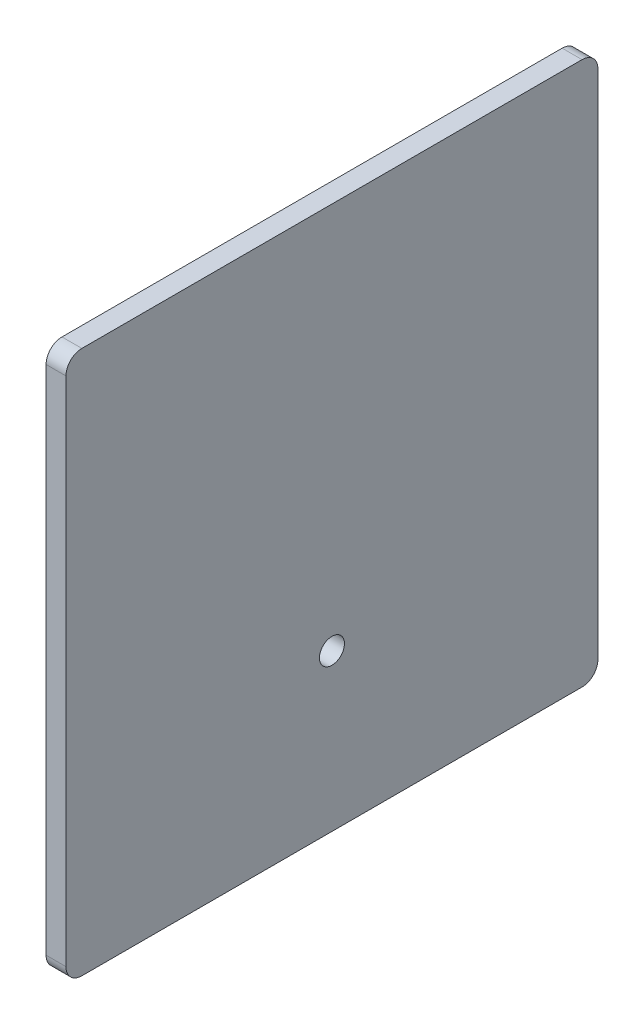
from build123d import *

# Parameters (mm, degrees)
SKETCH1_W           = 84.999999926
SKETCH1_H           = 86.825000086
BOSS_EXTRUDE1_DEPTH = 3.175
SKETCH2_R           = 2
CUT_EXTRUDE1_DEPTH  = 61.835645652
FILLET1_R           = 2.54


with BuildPart() as part:
    # Sketch1 → Boss-Extrude1 (new body)
    with BuildSketch(Plane(origin=(0, 0, 0), x_dir=(0, 0, -1), z_dir=(1, 0, 0))):
        Rectangle(SKETCH1_W, SKETCH1_H)
    extrude(amount=BOSS_EXTRUDE1_DEPTH)

    # Sketch2 → Cut-Extrude1 (cut, through all)
    with BuildSketch(Plane(origin=(3.175, 0, 0), x_dir=(0, 0, -1), z_dir=(1, 0, 0))):
        with Locations((3.7e-08, -18.412500043)):
            Circle(SKETCH2_R)
    extrude(amount=-CUT_EXTRUDE1_DEPTH, mode=Mode.SUBTRACT)

    # Fillet1
    fillet1_edges = [part.edges().sort_by_distance(p)[0] for p in [
        (1.5875, -43.412500043, 42.499999963),
        (1.5875, -43.412500043, -42.499999963),
        (1.5875, 43.412500043, -42.499999963),
        (1.5875, 43.412500043, 42.499999963),
    ]]
    fillet(fillet1_edges, radius=FILLET1_R)


solid = part.part
